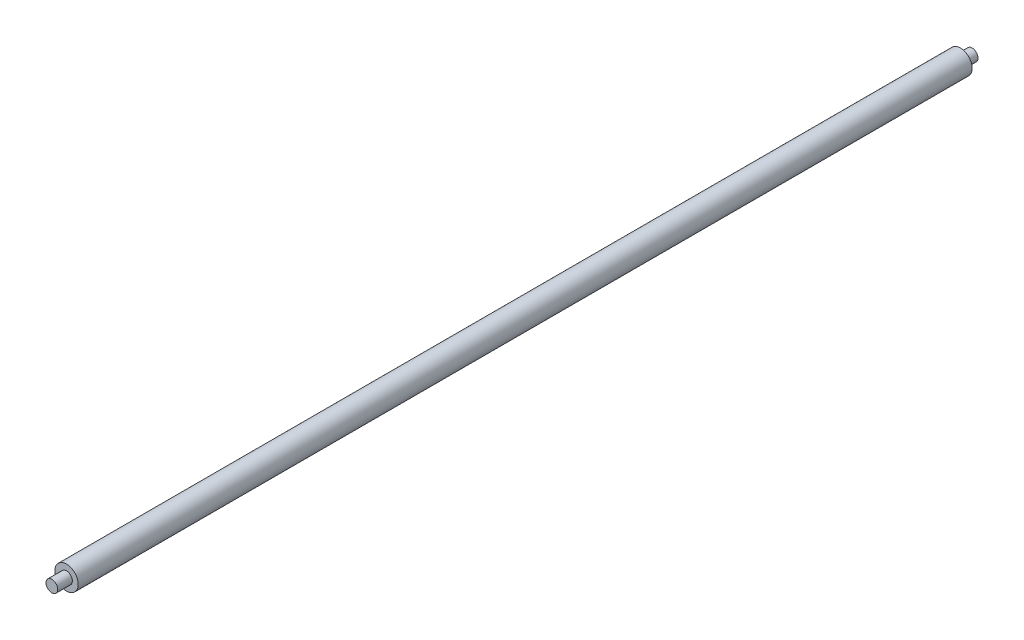
from build123d import *

# Parameters (mm, degrees)
SKETCH1_R           = 6
BOSS_EXTRUDE1_DEPTH = 235.5
SKETCH2_R           = 6
SKETCH2_R_2         = 3
CUT_EXTRUDE1_DEPTH  = 7.5
CUT_EXTRUDE2_START  = -6
SKETCH3_R           = 6
SKETCH3_R_2         = 3
CUT_EXTRUDE2_DEPTH  = 6


with BuildPart() as part:
    # Sketch1 → Boss-Extrude1 (new, symmetric)
    with BuildSketch(Plane.XY):
        Circle(SKETCH1_R)
    extrude(amount=BOSS_EXTRUDE1_DEPTH, both=True)

    # Sketch2 → Cut-Extrude1 (cut)
    with BuildSketch(Plane.XY.offset(235.5)):
        Circle(SKETCH2_R)
        Circle(SKETCH2_R_2, mode=Mode.SUBTRACT)
    extrude(amount=-CUT_EXTRUDE1_DEPTH, mode=Mode.SUBTRACT)

    # Sketch3 → Cut-Extrude2 (cut)
    with BuildSketch(Plane(origin=(0, 0, -235.5), x_dir=(-1, 0, 0), z_dir=(0, 0, -1)).offset(CUT_EXTRUDE2_START)):
        Circle(SKETCH3_R)
        Circle(SKETCH3_R_2, mode=Mode.SUBTRACT)
    extrude(amount=CUT_EXTRUDE2_DEPTH, mode=Mode.SUBTRACT)


solid = part.part
